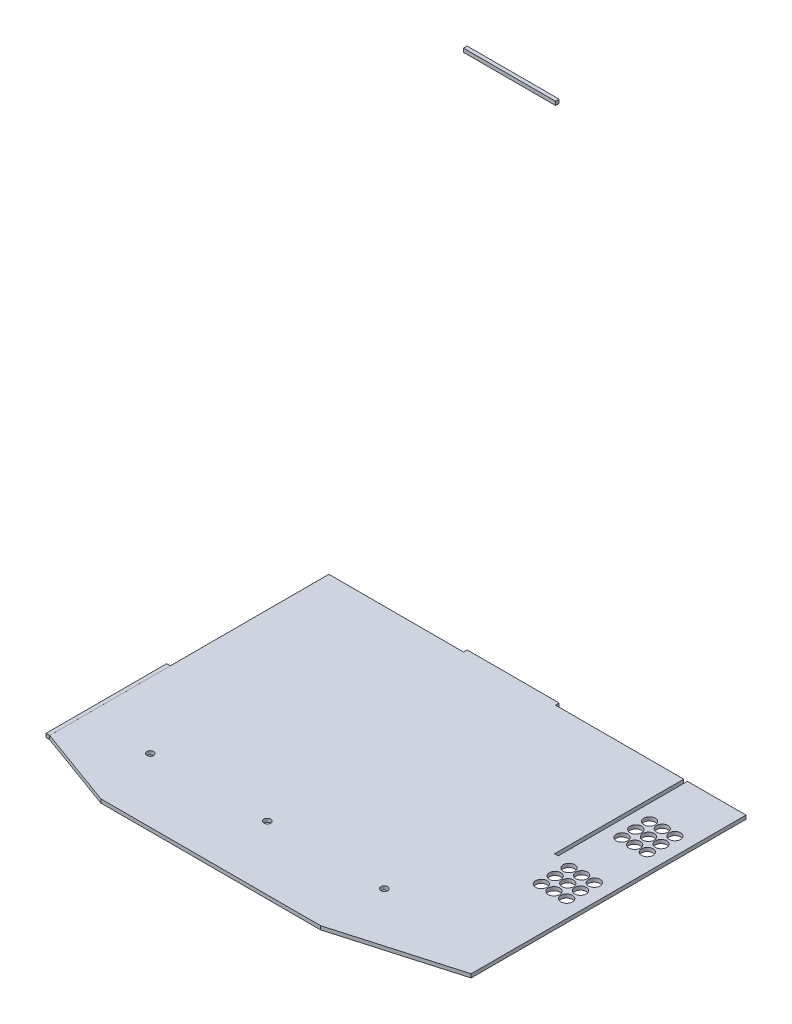
from build123d import *

# Parameters (mm, degrees)
SKETCH1_W           = 308.1112
SKETCH1_H           = 3.175
BOSS_EXTRUDE1_DEPTH = 267.83
SKETCH3_W           = 155.702
SKETCH3_H           = 3.175
BOSS_EXTRUDE3_DEPTH = 3.175
SKETCH4_W           = 50.87366
SKETCH4_H           = 3.175
BOSS_EXTRUDE4_DEPTH = 267.83
CUT_EXTRUDE1_DEPTH  = 340.190761306
CUT_EXTRUDE3_DEPTH  = 340.190761306
SKETCH13_R          = 5
CUT_EXTRUDE4_DEPTH  = 340.190761306
LPATTERN1_COUNT     = 3
LPATTERN1_PITCH     = 12
SKETCH17_W          = 104.775
SKETCH17_H          = 3.175
BOSS_EXTRUDE5_DEPTH = 3.175
SKETCH18_W          = 80
SKETCH18_H          = 3.175
BOSS_EXTRUDE6_DEPTH = 3.175
SKETCH19_W          = 80
SKETCH19_H          = 3.175
BOSS_EXTRUDE7_DEPTH = 3.175
SKETCH22_R          = 3
SKETCH22_R_2        = 0.027611819
CUT_EXTRUDE6_DEPTH  = 567.744985187
LPATTERN2_COUNT     = 3
LPATTERN2_PITCH     = 101.6


with BuildPart() as part:
    # Sketch1 → Boss-Extrude1 (new body)
    with BuildSketch(Plane.XY):
        Rectangle(SKETCH1_W, SKETCH1_H)
    extrude(amount=BOSS_EXTRUDE1_DEPTH)

    # Sketch3 → Boss-Extrude3 (add)
    with BuildSketch(Plane(origin=(154.0556, 0, 0), x_dir=(0, 0, -1), z_dir=(1, 0, 0))):
        with Locations((-189.979, 0)):
            Rectangle(SKETCH3_W, SKETCH3_H)
    extrude(amount=BOSS_EXTRUDE3_DEPTH)

    # Sketch4 → Boss-Extrude4 (add)
    with BuildSketch(Plane.XY.offset(267.83)):
        with Locations((182.66743, 0)):
            Rectangle(SKETCH4_W, SKETCH4_H)
    extrude(amount=-BOSS_EXTRUDE4_DEPTH)

    # Sketch6 → Cut-Extrude1 (cut, through all)
    with BuildSketch(Plane(origin=(0, 1.5875, 0), x_dir=(1, 0, 0), z_dir=(0, 1, 0))):
        Polygon((208.10426, -238.620139294), (106.50426, -267.83), (208.10426, -267.83), align=None)
    extrude(amount=-CUT_EXTRUDE1_DEPTH, mode=Mode.SUBTRACT)

    # Sketch11 → Cut-Extrude3 (cut, through all)
    with BuildSketch(Plane.XZ.offset(1.5875)):
        Polygon((-154.0556, 242.43), (-84.2056, 267.83), (-154.0556, 267.83), align=None)
    extrude(amount=-CUT_EXTRUDE3_DEPTH, mode=Mode.SUBTRACT)

    # Sketch13 → Cut-Extrude4 (cut, through all)
    with BuildSketch(Plane.XZ.offset(1.5875)):
        with Locations((171.04991, 116.644763656)):
            Circle(SKETCH13_R)
        with Locations((182.04991, 116.644763656)):
            Circle(SKETCH13_R)
        with Locations((193.04991, 116.644763656)):
            Circle(SKETCH13_R)
        with Locations((171.04991, 46.644823778)):
            Circle(SKETCH13_R)
        with Locations((182.04991, 46.644823778)):
            Circle(SKETCH13_R)
        with Locations((193.04991, 46.644823778)):
            Circle(SKETCH13_R)
    cut_extrude4 = extrude(amount=-CUT_EXTRUDE4_DEPTH, mode=Mode.SUBTRACT)

    # LPattern1: Cut-Extrude4 ×3
    with Locations(*[(0, 0, i * LPATTERN1_PITCH) for i in range(1, LPATTERN1_COUNT)]):
        add(cut_extrude4, mode=Mode.SUBTRACT)

    # Sketch17 → Boss-Extrude5 (add)
    with BuildSketch(Plane.ZY.offset(154.0556)):
        with Locations((190.037500036, 0.0104967)):
            Rectangle(SKETCH17_W, SKETCH17_H)
    extrude(amount=BOSS_EXTRUDE5_DEPTH)

    # Sketch18 → Boss-Extrude6 (add)
    with BuildSketch(Plane(origin=(0, 0, 0), x_dir=(-1, 0, 0), z_dir=(0, 0, -1))):
        with Locations((-2.78399998, 0)):
            Rectangle(SKETCH18_W, SKETCH18_H)
    extrude(amount=BOSS_EXTRUDE6_DEPTH)

    # Sketch22 → Cut-Extrude6 (cut, through all)
    with BuildSketch(Plane(origin=(0, 1.5875, 0), x_dir=(1, 0, 0), z_dir=(0, 1, 0))):
        with Locations((-96.771937601, -212.306759128)):
            Circle(SKETCH22_R)
        with Locations((-96.771937601, -212.306759128)):
            Circle(SKETCH22_R_2, mode=Mode.SUBTRACT)
    cut_extrude6 = extrude(amount=-CUT_EXTRUDE6_DEPTH, mode=Mode.SUBTRACT)


with BuildPart() as body_2:
    # Sketch19 → Boss-Extrude7 (new body)
    with BuildSketch(Plane(origin=(0, 0, 0), x_dir=(-1, 0, 0), z_dir=(0, 0, -1))):
        with Locations((-2.78399998, 454.048)):
            Rectangle(SKETCH19_W, SKETCH19_H)
    extrude(amount=BOSS_EXTRUDE7_DEPTH)


with BuildPart() as cut_extrude6_piece_1:
    # of the separate pieces the step leaves, piece 1, a body of its own (cut_extrude6_pieces)
    add(part.part.solids().sort_by_distance((-154.0556, -1.5875, 0))[0])

    # LPattern2: Cut-Extrude6 ×3
    with Locations(*[(i * LPATTERN2_PITCH, 0, 0) for i in range(1, LPATTERN2_COUNT)]):
        add(cut_extrude6, mode=Mode.SUBTRACT)


with BuildPart() as cut_extrude6_piece_2:
    # of the separate pieces the step leaves, piece 2, a body of its own (cut_extrude6_pieces)
    add(part.part.solids().sort_by_distance((-96.744325782, -1.5875, 212.306759128))[0])


solid = Compound([body_2.part, cut_extrude6_piece_1.part, cut_extrude6_piece_2.part])
